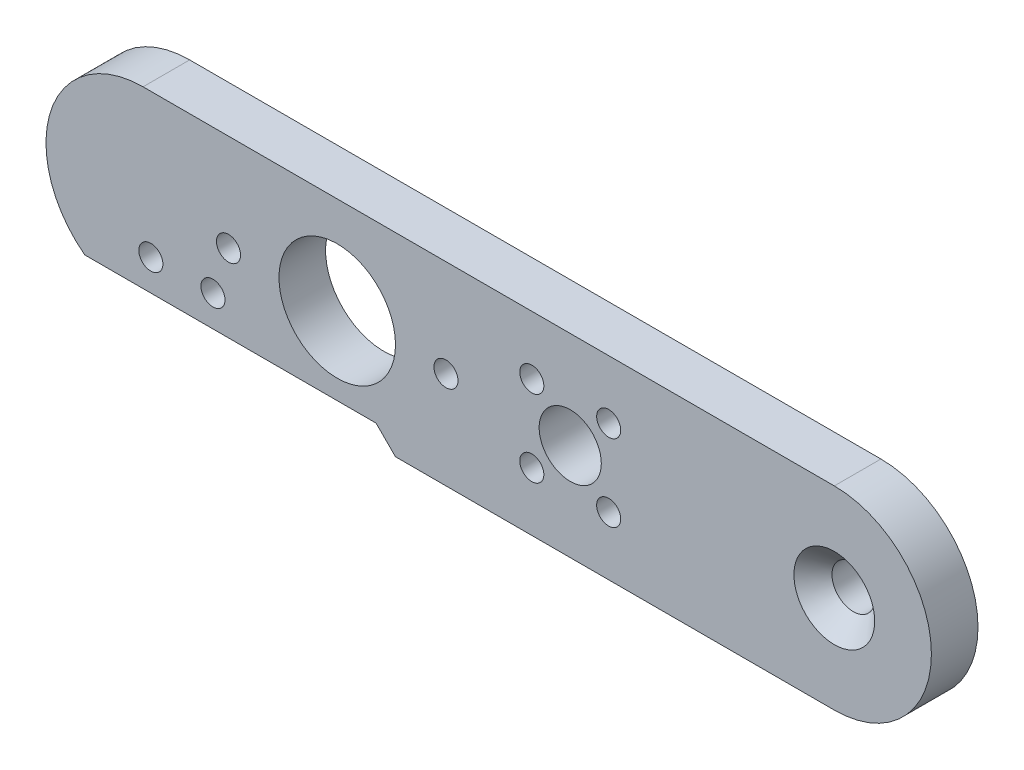
from build123d import *

# Parameters (mm, degrees)
SKETCH1_R                                       = 4
SKETCH1_R_2                                     = 1.55
SKETCH1_R_3                                     = 7.5
BOSS_EXTRUDE1_DEPTH                             = 6
CSK_FOR_M5_FLAT_HEAD_MACHINE_SCREW1_D           = 5.5
CSK_FOR_M5_FLAT_HEAD_MACHINE_SCREW1_CSINK_D     = 10.4
CSK_FOR_M5_FLAT_HEAD_MACHINE_SCREW1_CSINK_ANGLE = 90
SKETCH5_R                                       = 1.55
CUT_EXTRUDE1_DEPTH                              = 3
SKETCH6_R                                       = 3
CUT_EXTRUDE2_DEPTH                              = 59.431583925


with BuildPart() as part:
    # Sketch1 → Boss-Extrude1 (new body)
    with BuildSketch(Plane.XY):
        with BuildLine():
            Line((44.5, -12.5), (-12, -12.5))
            Line((-12, -12.5), (-14.5, -10))
            Line((-14.5, -10), (-52, -10))
            ThreePointArc((-52, -10), (-56.358541226, 3.952847075), (-44.5, 12.5))
            Line((-44.5, 12.5), (44.5, 12.5))
            ThreePointArc((44.5, 12.5), (57, 0), (44.5, -12.5))
        make_face()
        with Locations((10.5, 0)):
            Circle(SKETCH1_R, mode=Mode.SUBTRACT)
        with Locations((15.449747468, 4.949747468)):
            Circle(SKETCH1_R_2, mode=Mode.SUBTRACT)
        with Locations((5.550252532, 4.949747468)):
            Circle(SKETCH1_R_2, mode=Mode.SUBTRACT)
        with Locations((15.449747468, -4.949747468)):
            Circle(SKETCH1_R_2, mode=Mode.SUBTRACT)
        with Locations((5.550252532, -4.949747468)):
            Circle(SKETCH1_R_2, mode=Mode.SUBTRACT)
        with Locations((-19.5, 0)):
            Circle(SKETCH1_R_3, mode=Mode.SUBTRACT)
        with Locations((-5.5, 0)):
            Circle(SKETCH1_R_2, mode=Mode.SUBTRACT)
        with Locations((-33.5, 0)):
            Circle(SKETCH1_R_2, mode=Mode.SUBTRACT)
    extrude(amount=BOSS_EXTRUDE1_DEPTH)

    # CSK for M5 Flat Head Machine Screw1 (through all)
    with Locations(Plane.XY.offset(6)):
        with Locations((44.5, 0)):
            CounterSinkHole(CSK_FOR_M5_FLAT_HEAD_MACHINE_SCREW1_D / 2, CSK_FOR_M5_FLAT_HEAD_MACHINE_SCREW1_CSINK_D / 2, counter_sink_angle=CSK_FOR_M5_FLAT_HEAD_MACHINE_SCREW1_CSINK_ANGLE)

    # Sketch5 → Cut-Extrude1 (cut)
    with BuildSketch(Plane.XY.offset(6)):
        with Locations((-35.5, -6)):
            Circle(SKETCH5_R)
        with Locations((-43.5, -6)):
            Circle(SKETCH5_R)
    extrude(amount=-CUT_EXTRUDE1_DEPTH, mode=Mode.SUBTRACT)

    # Sketch6 → Cut-Extrude2 (cut, through all)
    with BuildSketch(Plane.XY.offset(3)):
        with Locations((-43.5, -6)):
            Circle(SKETCH6_R)
        with Locations((-35.5, -6)):
            Circle(SKETCH6_R)
    extrude(amount=-CUT_EXTRUDE2_DEPTH, mode=Mode.SUBTRACT)


solid = part.part
